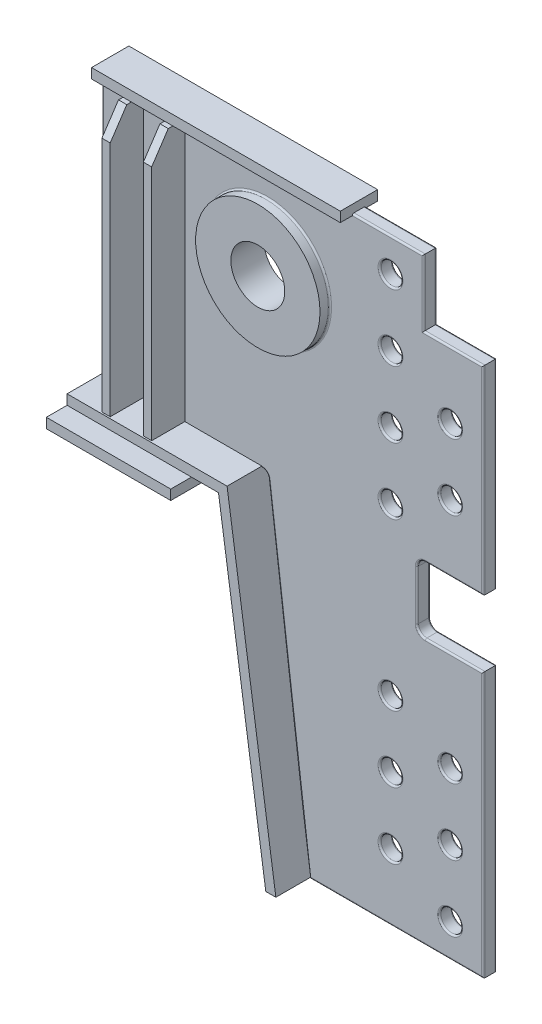
from build123d import *

# Parameters (mm, degrees)
SKETCH_1_R           = 13
SKETCH_1_R_2         = 37.5
EXTRUDE_1314_DEPTH   = 16
EXTRUDE_1_DEPTH      = 12
EXTRUDE_1_DEPTH_BACK = 28
SKETCH_2_R           = 75
SKETCH_2_R_2         = 32.5
FILLET_1_R           = 2
FILLET_2_R           = 2
EXTRUDE_2_DEPTH      = 40
EXTRUDE_2_DEPTH_BACK = 56
SKETCH_3_W           = 10
SKETCH_3_H           = 316
CUT_EXTRUDE_1_DEPTH  = 836.425640018
CUT_EXTRUDE_2_DEPTH  = 836.425640018
EXTRUDE_5_DEPTH      = 42
EXTRUDE_5_DEPTH_BACK = 58
EXTRUDE_6_DEPTH      = 14.5
EXTRUDE_6_DEPTH_BACK = 30.5
SKETCH_7_W           = 300
SKETCH_7_H           = 12
SKETCH_8_W           = 150
SKETCH_8_H           = 150
EXTRUDE_7_DEPTH      = 12


with BuildPart() as part:
    # 草图1 → Extrude 1314 (new body)
    with BuildSketch(Plane.XY):
        with BuildLine():
            Line((0, -320), (-70, -320))
            ThreePointArc((-70, -320), (-77.071067812, -322.928932188), (-80, -330))
            Line((-80, -330), (-80, -390))
            ThreePointArc((-80, -390), (-77.071067812, -397.071067812), (-70, -400))
            Line((-70, -400), (0, -400))
            Line((0, -400), (0, -720))
            Line((0, -720), (-210, -720))
            Line((-210, -720), (-259.124034735, -327.007722123))
            ThreePointArc((-259.124034735, -327.007722123), (-261.767837242, -322.002574593), (-267.062257748, -320))
            Line((-267.062257748, -320), (-460, -320))
            Line((-460, -320), (-460, 0))
            Line((-460, 0), (-72, 0))
            Line((-72, 0), (-72, -80))
            Line((-72, -80), (0, -80))
            Line((0, -80), (0, -320))
        make_face()
        with Locations((-112, -40)):
            Circle(SKETCH_1_R, mode=Mode.SUBTRACT)
        with Locations((-112, -120)):
            Circle(SKETCH_1_R, mode=Mode.SUBTRACT)
        with Locations((-112, -200)):
            Circle(SKETCH_1_R, mode=Mode.SUBTRACT)
        with Locations((-112, -280)):
            Circle(SKETCH_1_R, mode=Mode.SUBTRACT)
        with Locations((-40, -160)):
            Circle(SKETCH_1_R, mode=Mode.SUBTRACT)
        with Locations((-40, -240)):
            Circle(SKETCH_1_R, mode=Mode.SUBTRACT)
        with Locations((-40, -680)):
            Circle(SKETCH_1_R, mode=Mode.SUBTRACT)
        with Locations((-40, -600)):
            Circle(SKETCH_1_R, mode=Mode.SUBTRACT)
        with Locations((-40, -520)):
            Circle(SKETCH_1_R, mode=Mode.SUBTRACT)
        with Locations((-112, -640)):
            Circle(SKETCH_1_R, mode=Mode.SUBTRACT)
        with Locations((-112, -560)):
            Circle(SKETCH_1_R, mode=Mode.SUBTRACT)
        with Locations((-112, -480)):
            Circle(SKETCH_1_R, mode=Mode.SUBTRACT)
        with Locations((-260, -110)):
            Circle(SKETCH_1_R_2, mode=Mode.SUBTRACT)
    extrude(amount=EXTRUDE_1314_DEPTH)

    # 草图2 → 凸台-拉伸1 (add, two sides: drawn at the far end of the back side and taken through both)
    with BuildSketch(Plane.XY.offset(16).offset(-EXTRUDE_1_DEPTH_BACK)):
        with Locations((-260, -110)):
            Circle(SKETCH_2_R)
        with Locations((-260, -110)):
            Circle(SKETCH_2_R_2, mode=Mode.SUBTRACT)
    extrude(amount=EXTRUDE_1_DEPTH + EXTRUDE_1_DEPTH_BACK)

    # 圆角1
    fillet_1_edges = [part.edges().sort_by_distance(p)[0] for p in [
        (-335, -110, 16),
        (-125, -560, 16),
        (-53, -600, 16),
        (-53, -240, 16),
        (-35, -320, 16),
        (-77.071067812, -322.928932188, 16),
        (-80, -360, 16),
        (-77.071067812, -397.071067812, 16),
        (-35, -400, 16),
        (0, -560, 16),
        (-105, -720, 16),
        (-234.562017367, -523.503861062, 16),
        (-261.767837242, -322.002574593, 16),
        (-363.531128874, -320, 16),
        (-460, -160, 16),
        (-266, 0, 16),
        (-53, -680, 16),
        (-53, -520, 16),
        (-125, -480, 16),
        (-125, -640, 16),
        (-125, -280, 16),
        (-125, -120, 16),
        (-72, -40, 16),
        (-36, -80, 16),
        (0, -200, 16),
        (-125, -40, 16),
        (-125, -200, 16),
        (-53, -160, 16),
    ]]
    fillet(fillet_1_edges, radius=FILLET_1_R)

    # 圆角2
    fillet_2_edges = [part.edges().sort_by_distance(p)[0] for p in [
        (-335, -110, 0),
        (-125, -560, 0),
        (-53, -600, 0),
        (-53, -240, 0),
        (-266, 0, 0),
        (-460, -160, 0),
        (-363.531128874, -320, 0),
        (-261.767837242, -322.002574593, 0),
        (-234.562017367, -523.503861062, 0),
        (-105, -720, 0),
        (0, -560, 0),
        (-35, -400, 0),
        (-77.071067812, -397.071067812, 0),
        (-80, -360, 0),
        (-77.071067812, -322.928932188, 0),
        (-35, -320, 0),
        (-53, -680, 0),
        (-53, -520, 0),
        (-125, -480, 0),
        (-125, -640, 0),
        (-125, -280, 0),
        (-125, -120, 0),
        (0, -200, 0),
        (-36, -80, 0),
        (-72, -40, 0),
        (-125, -40, 0),
        (-125, -200, 0),
        (-53, -160, 0),
    ]]
    fillet(fillet_2_edges, radius=FILLET_2_R)

    # 草图3 → 凸台-拉伸2 (add, two sides: drawn at the far end of the back side and taken through both)
    with BuildSketch(Plane.XY.offset(16).offset(-EXTRUDE_2_DEPTH_BACK)):
        with Locations((-415, -160)):
            Rectangle(SKETCH_3_W, SKETCH_3_H)
        with Locations((-365, -160)):
            Rectangle(SKETCH_3_W, SKETCH_3_H)
    extrude(amount=EXTRUDE_2_DEPTH + EXTRUDE_2_DEPTH_BACK)

    # 草图4 → 切除-拉伸1 (cut, through all)
    with BuildSketch(Plane.ZY.offset(420)):
        Polygon((-20, -2), (-45.5, -32), (-45.5, -2), align=None)
    extrude(amount=-CUT_EXTRUDE_1_DEPTH, mode=Mode.SUBTRACT)

    # 草图5 → 切除-拉伸2 (cut, through all)
    with BuildSketch(Plane.ZY.offset(420)):
        Polygon((36, -2), (56, -32), (56, -2), align=None)
    extrude(amount=-CUT_EXTRUDE_2_DEPTH, mode=Mode.SUBTRACT)

    # 草图6 → 凸台-拉伸5 (add, two sides: drawn at the far end of the back side and taken through both)
    with BuildSketch(Plane.XY.offset(16).offset(-EXTRUDE_5_DEPTH_BACK)):
        Polygon((-267.062257748, -318), (-460, -318), (-460, -330), (-277.426505546, -330), (-220.363518026, -718), (-208.234435563, -718), align=None)
    extrude(amount=EXTRUDE_5_DEPTH + EXTRUDE_5_DEPTH_BACK)

    # 草图7 → 凸台-拉伸6 (add, two sides: drawn at the far end of the back side and taken through both)
    with BuildSketch(Plane(origin=(0, 0, 0), x_dir=(-1, 0, 0), z_dir=(0, 0, -1)).offset(-EXTRUDE_6_DEPTH_BACK)):
        with Locations((308, 4)):
            Rectangle(SKETCH_7_W, SKETCH_7_H)
    extrude(amount=EXTRUDE_6_DEPTH + EXTRUDE_6_DEPTH_BACK)

    # 草图8 → 凸台-拉伸7 (add)
    with BuildSketch(Plane.XZ.offset(330)):
        with Locations((-385, 8)):
            Rectangle(SKETCH_8_W, SKETCH_8_H)
    extrude(amount=EXTRUDE_7_DEPTH)


solid = part.part
